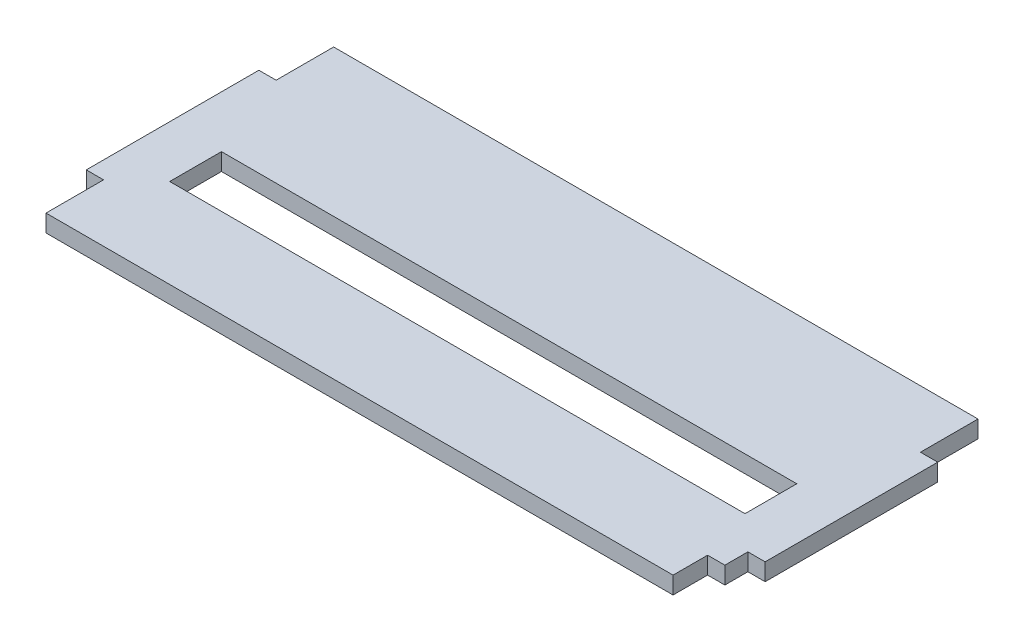
from build123d import *

# Parameters (mm, degrees)
LED_1_OUTLINE_R     = 2.25
LED_1_DEPTH         = 3
SKETCH_1_W          = 100
SKETCH_1_H          = 9
CUT_EXTRUDE_1_DEPTH = 3


# Read off the part's stored shape, not the designer's step: 基体零件-LED板-1
with BuildPart() as part:
    # 基体零件-LED板-1 outline → 基体零件-LED板-1 (new body)
    with BuildSketch(Plane(origin=(0, 0, 0), x_dir=(1, 0, 0), z_dir=(0, 1, 0))):
        Polygon((-3, -140), (0, -140), (0, -110), (-3, -110), (-3, -100), (-115, -100), (-115, -110), (-118, -110), (-118, -140), (-115, -140), (-115, -150), (-6.001970153, -150), (-6.001970153, -144), (-3, -144), align=None)
        with Locations((-90.5, -130)):
            Circle(LED_1_OUTLINE_R, mode=Mode.SUBTRACT)
        with Locations((-81.5, -130)):
            Circle(LED_1_OUTLINE_R, mode=Mode.SUBTRACT)
        with Locations((-72.5, -130)):
            Circle(LED_1_OUTLINE_R, mode=Mode.SUBTRACT)
        with Locations((-63.5, -130)):
            Circle(LED_1_OUTLINE_R, mode=Mode.SUBTRACT)
        with Locations((-54.5, -130)):
            Circle(LED_1_OUTLINE_R, mode=Mode.SUBTRACT)
        with Locations((-45.5, -130)):
            Circle(LED_1_OUTLINE_R, mode=Mode.SUBTRACT)
        with Locations((-36.5, -130)):
            Circle(LED_1_OUTLINE_R, mode=Mode.SUBTRACT)
        with Locations((-27.5, -130)):
            Circle(LED_1_OUTLINE_R, mode=Mode.SUBTRACT)
    extrude(amount=LED_1_DEPTH)

    # 草图1 → 切除-拉伸1 (cut)
    with BuildSketch(Plane(origin=(0, 3, 0), x_dir=(1, 0, 0), z_dir=(0, 1, 0))):
        with Locations((-59, -130)):
            Rectangle(SKETCH_1_W, SKETCH_1_H)
    extrude(amount=-CUT_EXTRUDE_1_DEPTH, mode=Mode.SUBTRACT)


solid = part.part
